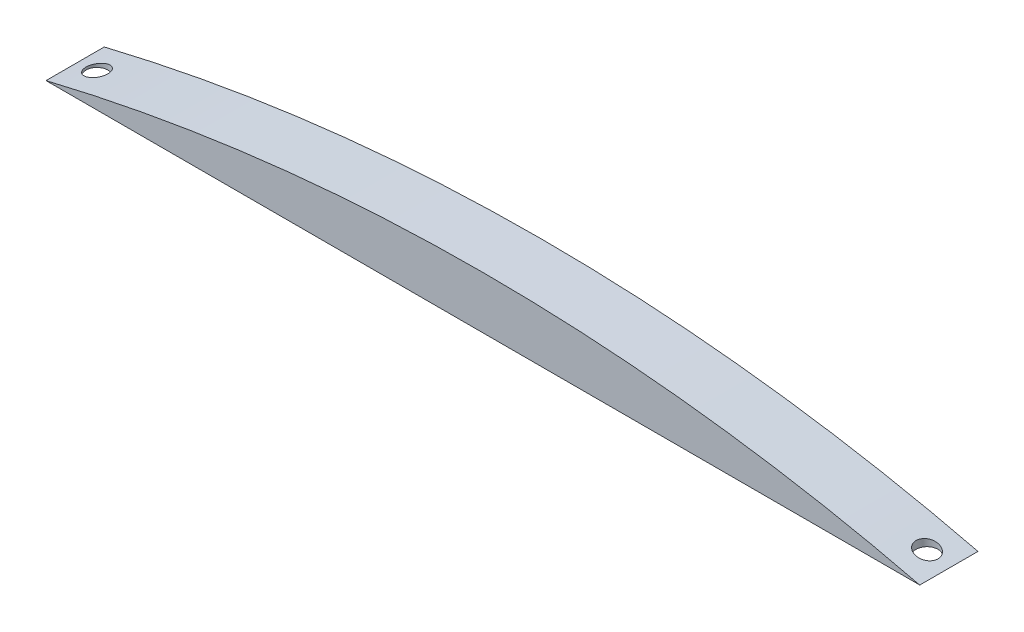
from build123d import *

# Parameters (mm, degrees)
BOSS_EXTRUDE3_DEPTH = 25.4
SKETCH2_R           = 4.7625
CUT_EXTRUDE1_DEPTH  = 25.4


with BuildPart() as part:
    # Sketch1 → Boss-Extrude3 (new body)
    with BuildSketch(Plane.XY):
        with BuildLine():
            ThreePointArc((190.5, 0), (0, 22.819041954), (-190.5, 0))
            Line((-190.5, 0), (-180.975, 0))
            Line((-180.975, 0), (180.975, 0))
            Line((180.975, 0), (190.5, 0))
        make_face()
    extrude(amount=BOSS_EXTRUDE3_DEPTH)

    # Sketch2 → Cut-Extrude1 (cut)
    with BuildSketch(Plane.XZ):
        with Locations((180.975, 12.7)):
            Circle(SKETCH2_R)
        with Locations((-180.975, 12.7)):
            Circle(SKETCH2_R)
    extrude(amount=-CUT_EXTRUDE1_DEPTH, mode=Mode.SUBTRACT)


solid = part.part
